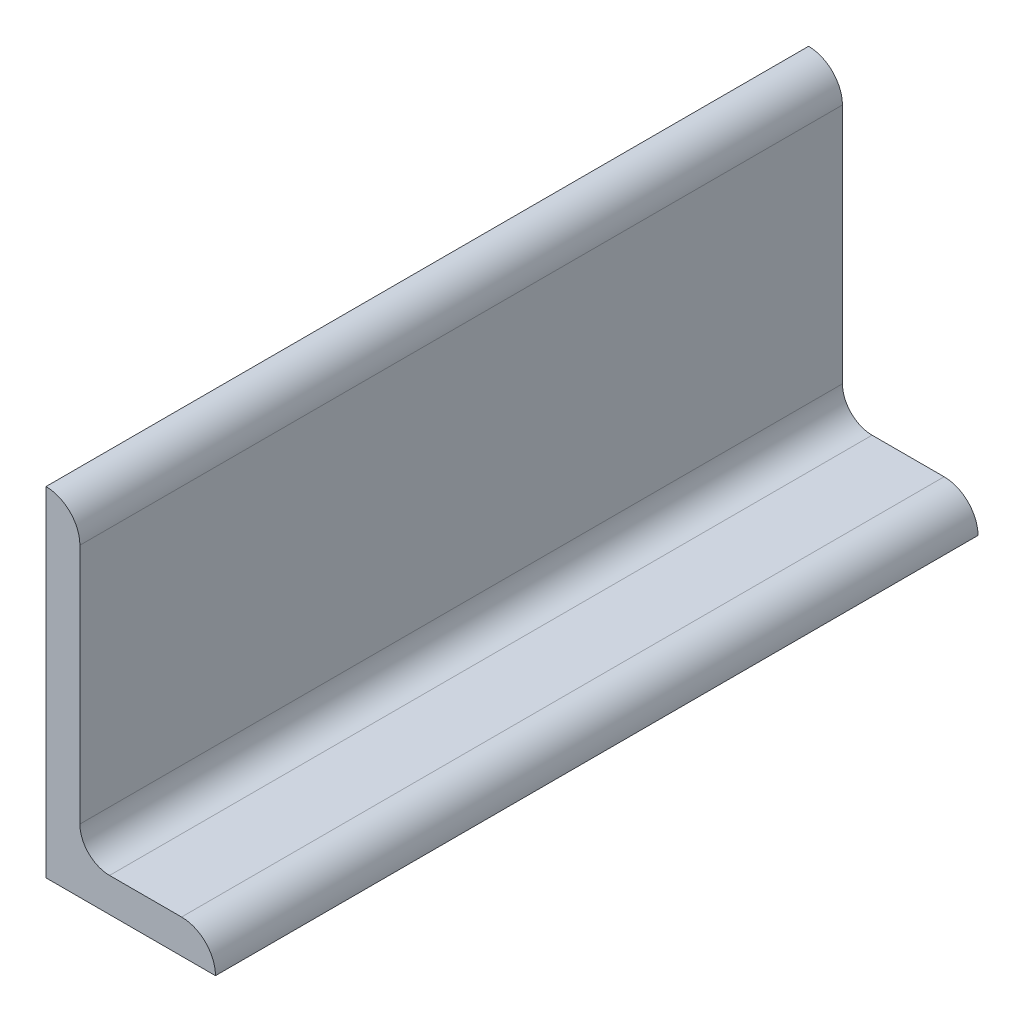
from build123d import *

# Parameters (mm, degrees)
BASESTEELANGLE_DEPTH = 90
TOEFILLET_R          = 8


with BuildPart() as part:
    # Sketch1 → BaseSteelAngle (new, symmetric)
    with BuildSketch(Plane.XY):
        with BuildLine():
            Line((0, 80), (0, 0))
            Line((0, 0), (40, 0))
            Line((40, 0), (40, 8))
            Line((40, 8), (15, 8))
            ThreePointArc((15, 8), (10.050252532, 10.050252532), (8, 15))
            Line((8, 15), (8, 80))
            Line((8, 80), (0, 80))
        make_face()
    extrude(amount=BASESTEELANGLE_DEPTH, both=True)

    # ToeFillet
    toefillet_edges = [part.edges().sort_by_distance(p)[0] for p in [
        (8, 80, 0),
        (40, 8, 0),
    ]]
    fillet(toefillet_edges, radius=TOEFILLET_R - 0.0001)  # a hair under: the kernel refuses the full size


solid = part.part
